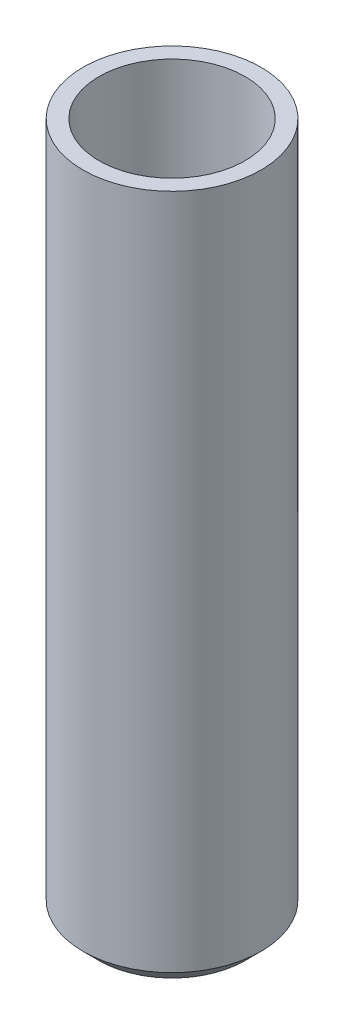
from build123d import *

# Parameters (mm, degrees)
SKETCH_1_R          = 2.5
EXTRUDE_1_DEPTH     = 20
SKETCH_2_R          = 2.05
CUT_EXTRUDE_1_DEPTH = 21.310096012
CHAMFER_1_SIZE      = 1


with BuildPart() as part:
    # 草图1 → 凸台-拉伸1 (new body)
    with BuildSketch(Plane(origin=(0, 0, 0), x_dir=(1, 0, 0), z_dir=(0, 1, 0))):
        with Locations(Location((0, 0, 0), (0, 0, 270))):
            Circle(SKETCH_1_R)
    extrude(amount=EXTRUDE_1_DEPTH)

    # 草图2 → 切除-拉伸1 (cut, through all)
    with BuildSketch(Plane.XZ):
        with Locations(Location((0, 0, 0), (0, 0, 270))):
            Circle(SKETCH_2_R)
    extrude(amount=-CUT_EXTRUDE_1_DEPTH, mode=Mode.SUBTRACT)

    # 倒角1
    # the kernel refuses this chamfer: 1 mm, written as the material it takes off along each edge
    with BuildSketch(Plane(origin=(0, 0, 0), x_dir=(0, 0, 1), z_dir=(-1, 0, 0))) as chamfer_1_piece_1:
        Polygon((2.5, CHAMFER_1_SIZE), (2.5 - CHAMFER_1_SIZE, 0), (2.5, 0), align=None)
    revolve(axis=Axis((0, 0, 0), (0, 1, 0)), mode=Mode.SUBTRACT)


solid = part.part
